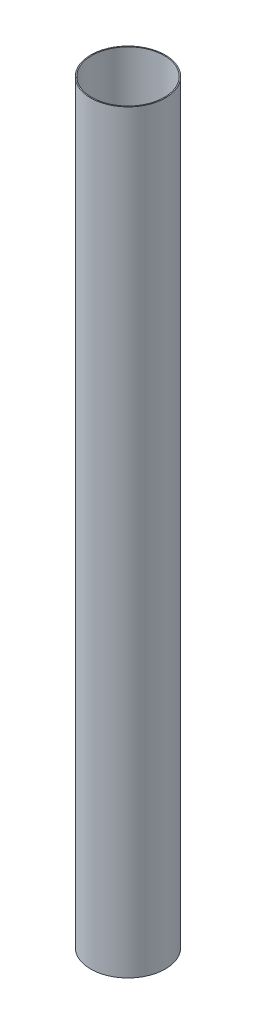
from build123d import *

# Parameters (mm, degrees)
SKETCH1_R      = 46.1137
SKETCH1_R_2    = 44.8437
EXTRUDE1_DEPTH = 932.62666662


with BuildPart() as part:
    # Sketch1 → Extrude1 (new body)
    with BuildSketch(Plane(origin=(0, 0, 0), x_dir=(1, 0, 0), z_dir=(0, 1, 0))):
        Circle(SKETCH1_R)
        Circle(SKETCH1_R_2, mode=Mode.SUBTRACT)
    extrude(amount=EXTRUDE1_DEPTH)


solid = part.part
